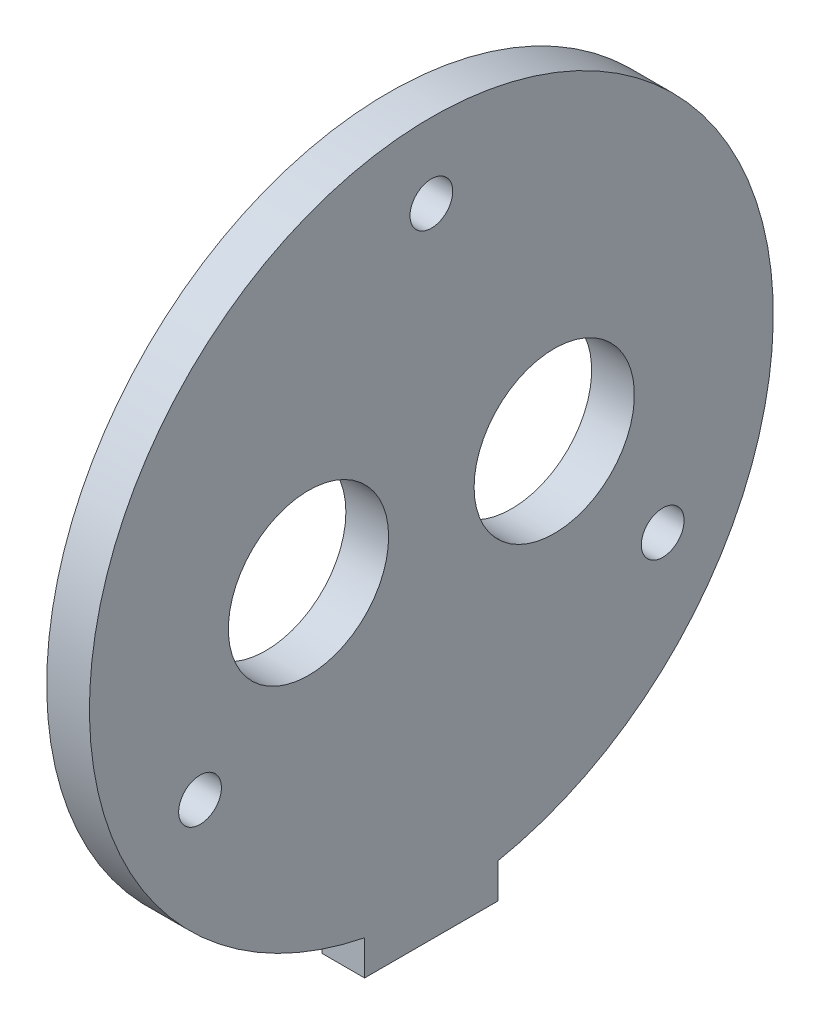
from build123d import *

# Parameters (mm, degrees)
SKETCH1_R           = 4
SKETCH1_R_2         = 15
BOSS_EXTRUDE1_DEPTH = 8


with BuildPart() as part:
    # Sketch1 → Boss-Extrude1 (new body)
    with BuildSketch(Plane(origin=(0, 0, 0), x_dir=(0, 0, -1), z_dir=(1, 0, 0))):
        with BuildLine():
            Line((-12.5, -62.767427859), (-12.5, -69.29))
            Line((-12.5, -69.29), (12.5, -69.29))
            Line((12.5, -69.29), (12.5, -62.767427859))
            ThreePointArc((12.5, -62.767427859), (0, 64), (-12.5, -62.767427859))
        make_face()
        with Locations((0, 50)):
            Circle(SKETCH1_R, mode=Mode.SUBTRACT)
        with Locations((43.301270189, -25)):
            Circle(SKETCH1_R, mode=Mode.SUBTRACT)
        with Locations((-43.301270189, -25)):
            Circle(SKETCH1_R, mode=Mode.SUBTRACT)
        with Locations((-23, 0)):
            Circle(SKETCH1_R_2, mode=Mode.SUBTRACT)
        with Locations((23, 0)):
            Circle(SKETCH1_R_2, mode=Mode.SUBTRACT)
    extrude(amount=BOSS_EXTRUDE1_DEPTH)


solid = part.part
